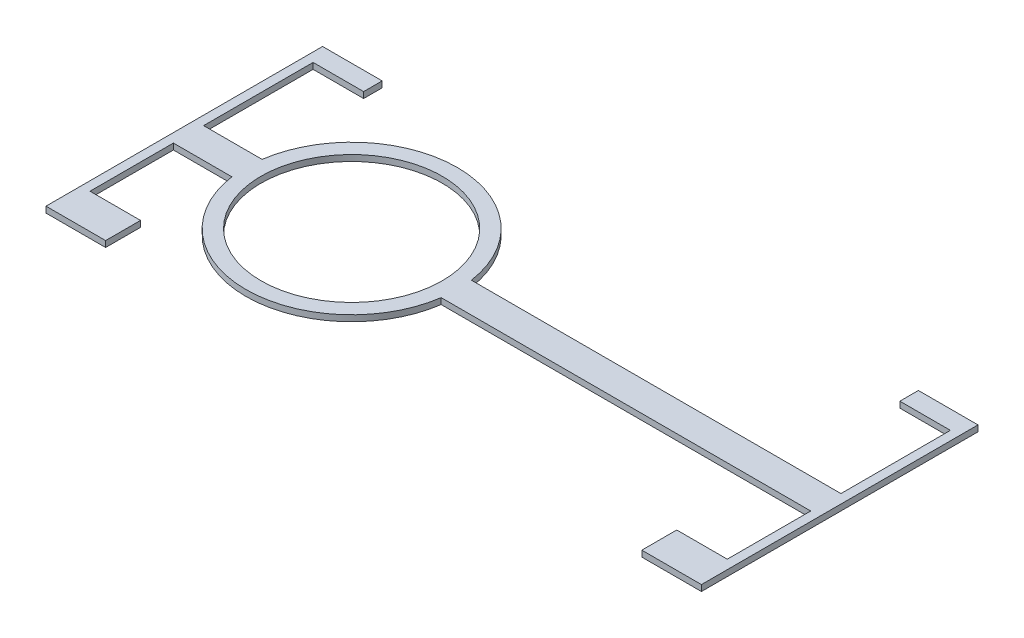
from build123d import *

# Parameters (mm, degrees)
SKETCH_2_R      = 30
EXTRUDE_1_DEPTH = 2


with BuildPart() as part:
    # 스케치2 → 보스-돌출1 (new body)
    with BuildSketch(Plane(origin=(0, 0, 0), x_dir=(1, 0, 0), z_dir=(0, 1, 0))):
        with BuildLine():
            Line((-105.5, 41.243665035), (-105.5, 5))
            Line((-105.5, 5), (-86.141016151, 5))
            ThreePointArc((-86.141016151, 5), (-51.5, 35), (-16.858983849, 5))
            Line((-16.858983849, 5), (105.5, 5))
            Line((105.5, 5), (105.5, 41.243665035))
            Line((105.5, 41.243665035), (88.764162696, 41.243665035))
            Line((88.764162696, 41.243665035), (88.764162696, 47.380674769))
            Line((88.764162696, 47.380674769), (108.5, 47.380674769))
            Line((108.5, 47.380674769), (108.5, -44.184758461))
            Line((108.5, -44.184758461), (88.764162696, -44.184758461))
            Line((88.764162696, -44.184758461), (88.764162696, -32.624550413))
            Line((88.764162696, -32.624550413), (105.5, -32.624550413))
            Line((105.5, -32.624550413), (105.5, -5))
            Line((105.5, -5), (-16.858983849, -5))
            ThreePointArc((-16.858983849, -5), (-51.5, -35), (-86.141016151, -5))
            Line((-86.141016151, -5), (-105.5, -5))
            Line((-105.5, -5), (-105.5, -32.624550413))
            Line((-105.5, -32.624550413), (-88.764162696, -32.624550413))
            Line((-88.764162696, -32.624550413), (-88.764162696, -44.184758461))
            Line((-88.764162696, -44.184758461), (-108.5, -44.184758461))
            Line((-108.5, -44.184758461), (-108.5, 47.380674769))
            Line((-108.5, 47.380674769), (-88.764162696, 47.380674769))
            Line((-88.764162696, 47.380674769), (-88.764162696, 41.243665035))
            Line((-88.764162696, 41.243665035), (-105.5, 41.243665035))
        make_face()
        with Locations((-51.5, 0)):
            Circle(SKETCH_2_R, mode=Mode.SUBTRACT)
    extrude(amount=EXTRUDE_1_DEPTH)


solid = part.part
